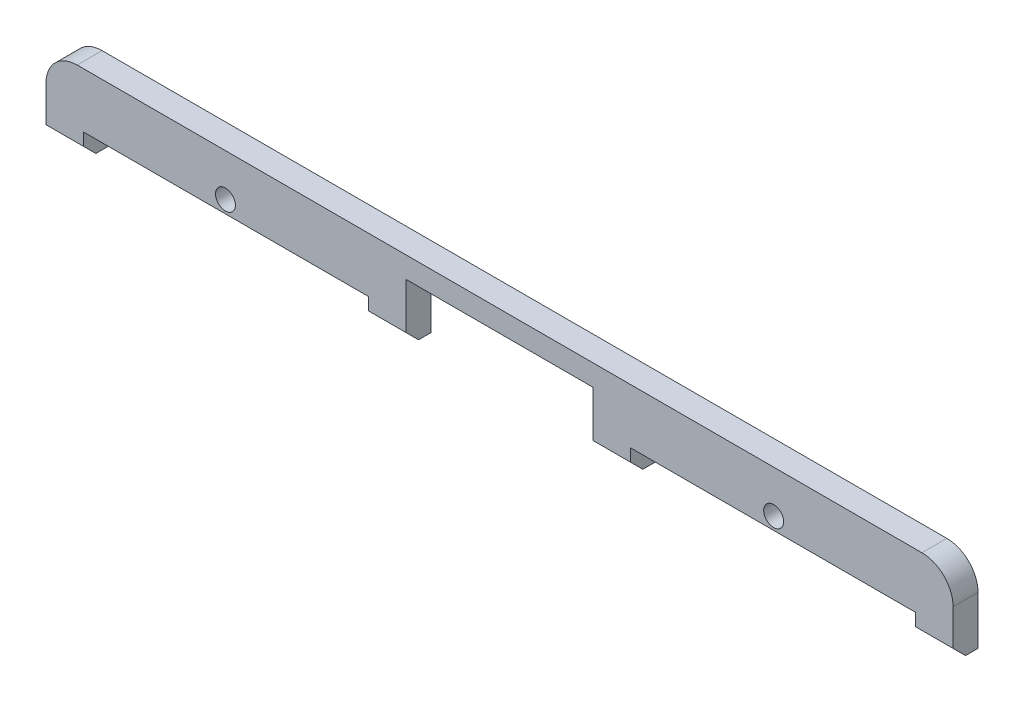
from build123d import *

# Parameters (mm, degrees)
BOSS_EXTRUDE1_DEPTH       = 36.4
FILLET3_R                 = 2.5
M2X0_4_TAPPED_HOLE1_D     = 1.6
M2X0_4_TAPPED_HOLE1_DEPTH = 3.6
M2X0_4_TAPPED_HOLE1_TIP   = 0.480688495
SKETCH4_W                 = 15
SKETCH4_H                 = 4.7
CUT_EXTRUDE4_DEPTH        = 5
BOSS_EXTRUDE3_DEPTH       = 3
BOSS_EXTRUDE5_DEPTH       = 3


with BuildPart() as part:
    # Sketch1 → Boss-Extrude1 (new, symmetric)
    with BuildSketch(Plane(origin=(0, 0, 0), x_dir=(0, 0, -1), z_dir=(1, 0, 0))):
        Polygon((0, -3.2), (-2, -1.2), (-2, 3.2), (0, 3.2), align=None)
    extrude(amount=BOSS_EXTRUDE1_DEPTH, both=True)

    # Fillet3
    fillet3_edges = [part.edges().sort_by_distance(p)[0] for p in [
        (-36.4, 3.2, 1),
        (36.4, 3.2, 1),
    ]]
    fillet(fillet3_edges, radius=FILLET3_R)

    # M2x0.4 Tapped Hole1
    with Locations(Plane.XY.offset(2)):
        with Locations((-22, -0.2), (22, -0.2), (0, -0.2)):
            Hole(M2X0_4_TAPPED_HOLE1_D / 2, depth=M2X0_4_TAPPED_HOLE1_DEPTH)
            with Locations((0, 0, -(M2X0_4_TAPPED_HOLE1_DEPTH + M2X0_4_TAPPED_HOLE1_TIP / 2))):  # 118° drill point
                Cone(0, M2X0_4_TAPPED_HOLE1_D / 2, M2X0_4_TAPPED_HOLE1_TIP, mode=Mode.SUBTRACT)

    # Sketch4 → Cut-Extrude4 (cut, symmetric)
    with BuildSketch(Plane.XY):
        with Locations((0, -0.85)):
            Rectangle(SKETCH4_W, SKETCH4_H)
    cut_extrude4 = extrude(amount=CUT_EXTRUDE4_DEPTH, both=True, mode=Mode.SUBTRACT)

    # Sketch8 → Boss-Extrude3 (add)
    with BuildSketch(Plane(origin=(36.4, 0, 0), x_dir=(0, 0, -1), z_dir=(1, 0, 0))):
        Polygon((-1, -3.2), (-2, -2.2), (-2, -1.2), (0, -3.2), align=None)
    boss_extrude3 = extrude(amount=-BOSS_EXTRUDE3_DEPTH)

    # Sketch10 → Boss-Extrude5 (add)
    with BuildSketch(Plane.ZY.offset(-7.5)):
        Polygon((1, -3.2), (2, -2.2), (2, -1.2), (0, -3.2), align=None)
    boss_extrude5 = extrude(amount=-BOSS_EXTRUDE5_DEPTH)

    # Mirror1: Cut-Extrude4, Boss-Extrude3, Boss-Extrude5 across plane
    add(cut_extrude4.mirror(Plane(origin=(0, 0, 0), x_dir=(0, 0, 1), z_dir=(1, 0, 0))), mode=Mode.SUBTRACT)
    add(boss_extrude3.mirror(Plane(origin=(0, 0, 0), x_dir=(0, 0, 1), z_dir=(1, 0, 0))))
    add(boss_extrude5.mirror(Plane(origin=(0, 0, 0), x_dir=(0, 0, 1), z_dir=(1, 0, 0))))


solid = part.part
